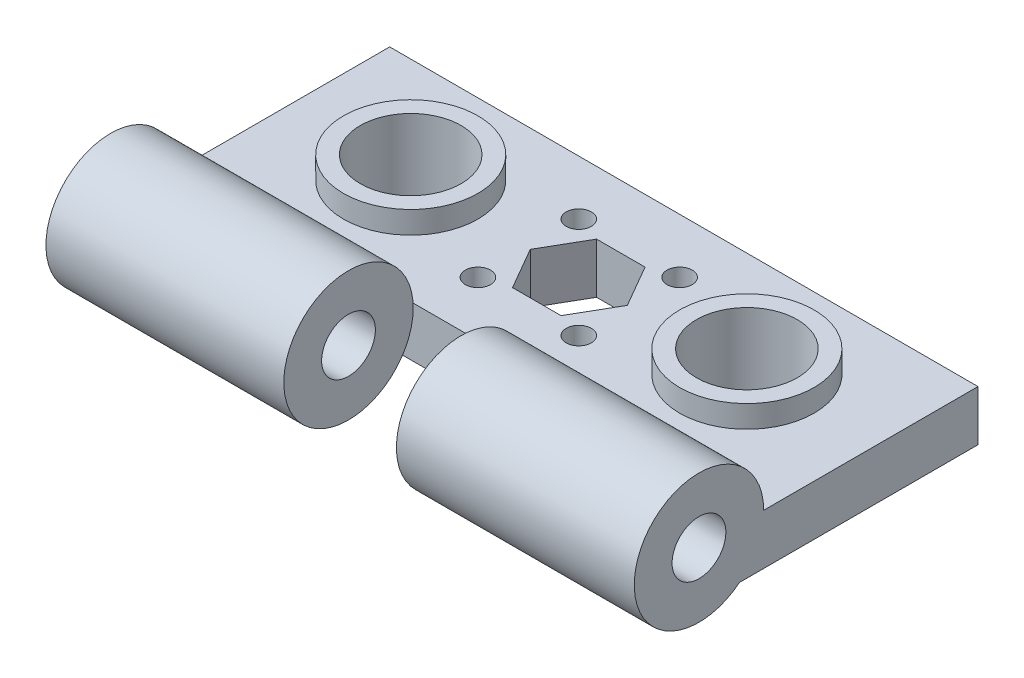
from build123d import *

# Parameters (mm, degrees)
SKETCH1_R                       = 6
SKETCH1_R_2                     = 1.5
BOSS_EXTRUDE1_DEPTH             = 6
BOSS_EXTRUDE2_DEPTH             = 5.65
BOSS_EXTRUDE2_DEPTH_BACK        = 5.65
SKETCH2_R                       = 8
SKETCH2_R_2                     = 6
BOSS_EXTRUDE9_REACH             = 69.637
SKETCH3_R                       = 7.7
SKETCH3_R_2                     = 3.2
BOSS_EXTRUDE9_DIRECTION_2_REACH = 69.637
CUT_EXTRUDE1_DEPTH              = 6.7
CUT_EXTRUDE1_DEPTH_BACK         = 6.7
SKETCH4_R                       = 7.7


with BuildPart() as part:
    # Sketch1 → Boss-Extrude1 (new body)
    with BuildSketch(Plane(origin=(0, 0, 0), x_dir=(1, 0, 0), z_dir=(0, 1, 0))):
        Polygon((70, 0), (60, 0), (60, 5), (10, 5), (10, 0), (0, 0), (0, 30), (70, 30), align=None)
        with Locations((15, 17.5)):
            Circle(SKETCH1_R, mode=Mode.SUBTRACT)
        with Locations((55, 17.5)):
            Circle(SKETCH1_R, mode=Mode.SUBTRACT)
        with Locations((41, 23.5)):
            Circle(SKETCH1_R_2, mode=Mode.SUBTRACT)
        with Locations((29, 23.5)):
            Circle(SKETCH1_R_2, mode=Mode.SUBTRACT)
        with Locations((29, 11.5)):
            Circle(SKETCH1_R_2, mode=Mode.SUBTRACT)
        with Locations((41, 11.5)):
            Circle(SKETCH1_R_2, mode=Mode.SUBTRACT)
        Polygon((40.773502692, 17.5), (37.886751346, 22.5), (32.113248654, 22.5), (29.226497308, 17.5), (32.113248654, 12.5), (37.886751346, 12.5), align=None, mode=Mode.SUBTRACT)
    extrude(amount=BOSS_EXTRUDE1_DEPTH)

    # Sketch2 → Boss-Extrude2 (add, two sides: drawn at the far end of the back side and taken through both)
    # profile 1 of 2: a face of its own
    with BuildSketch(Plane(origin=(0, 3, 0), x_dir=(1, 0, 0), z_dir=(0, 1, 0)).offset(-BOSS_EXTRUDE2_DEPTH_BACK)):
        with Locations((15, 17.5)):
            Circle(SKETCH2_R)
        with Locations((15, 17.5)):
            Circle(SKETCH2_R_2, mode=Mode.SUBTRACT)
    # profile 2 of 2: a face of its own
    with BuildSketch(Plane(origin=(0, 3, 0), x_dir=(1, 0, 0), z_dir=(0, 1, 0)).offset(-BOSS_EXTRUDE2_DEPTH_BACK)):
        with Locations((55, 17.5)):
            Circle(SKETCH2_R)
        with Locations((55, 17.5)):
            Circle(SKETCH2_R_2, mode=Mode.SUBTRACT)
    extrude(amount=BOSS_EXTRUDE2_DEPTH + BOSS_EXTRUDE2_DEPTH_BACK)

    # Boss-Extrude9: up to this face of the body (flat: up to its plane)
    boss_extrude9_end = Plane(part.part.faces().sort_by_distance((70, 3, -15))[0])
    # Sketch3 → Boss-Extrude9 (add, up to the picked face)
    with BuildSketch(Plane(origin=(10, 0, 0), x_dir=(0, 0, -1), z_dir=(1, 0, 0)), mode=Mode.PRIVATE) as boss_extrude9_sk1:
        with Locations((-3.2, 6)):
            Circle(SKETCH3_R)
        with Locations((-3.2, 6)):
            Circle(SKETCH3_R_2, mode=Mode.SUBTRACT)
    boss_extrude9_tool1 = split(extrude(boss_extrude9_sk1.sketch, amount=BOSS_EXTRUDE9_REACH, mode=Mode.PRIVATE), bisect_by=boss_extrude9_end, keep=Keep.BOTH, mode=Mode.PRIVATE)
    add(boss_extrude9_tool1.solids().sort_by(Axis((10, 6, 10.682211), (1, 0, 0)))[0])

    # Boss-Extrude9 direction 2: up to this face of the body (flat: up to its plane)
    boss_extrude9_direction_2_end = Plane(part.part.faces().sort_by_distance((0, 3, -15))[0])
    # Sketch3 → Boss-Extrude9 direction 2 (add, up to the picked face)
    with BuildSketch(Plane(origin=(10, 0, 0), x_dir=(0, 0, -1), z_dir=(1, 0, 0)), mode=Mode.PRIVATE) as boss_extrude9_direction_2_sk1:
        with Locations((-3.2, 6)):
            Circle(SKETCH3_R)
        with Locations((-3.2, 6)):
            Circle(SKETCH3_R_2, mode=Mode.SUBTRACT)
    boss_extrude9_direction_2_tool1 = split(extrude(boss_extrude9_direction_2_sk1.sketch, amount=-BOSS_EXTRUDE9_DIRECTION_2_REACH, mode=Mode.PRIVATE), bisect_by=boss_extrude9_direction_2_end, keep=Keep.BOTH, mode=Mode.PRIVATE)
    add(boss_extrude9_direction_2_tool1.solids().sort_by(Axis((10, 6, 10.682211), (-1, 0, 0)))[0])

    # Sketch4 → Cut-Extrude1 (cut, two sides: drawn at the far end of the back side and taken through both)
    with BuildSketch(Plane(origin=(35, 0, 0), x_dir=(0, 0, -1), z_dir=(1, 0, 0)).offset(-CUT_EXTRUDE1_DEPTH_BACK)):
        with Locations((-3.2, 6)):
            Circle(SKETCH4_R)
    extrude(amount=CUT_EXTRUDE1_DEPTH + CUT_EXTRUDE1_DEPTH_BACK, mode=Mode.SUBTRACT)


solid = part.part
